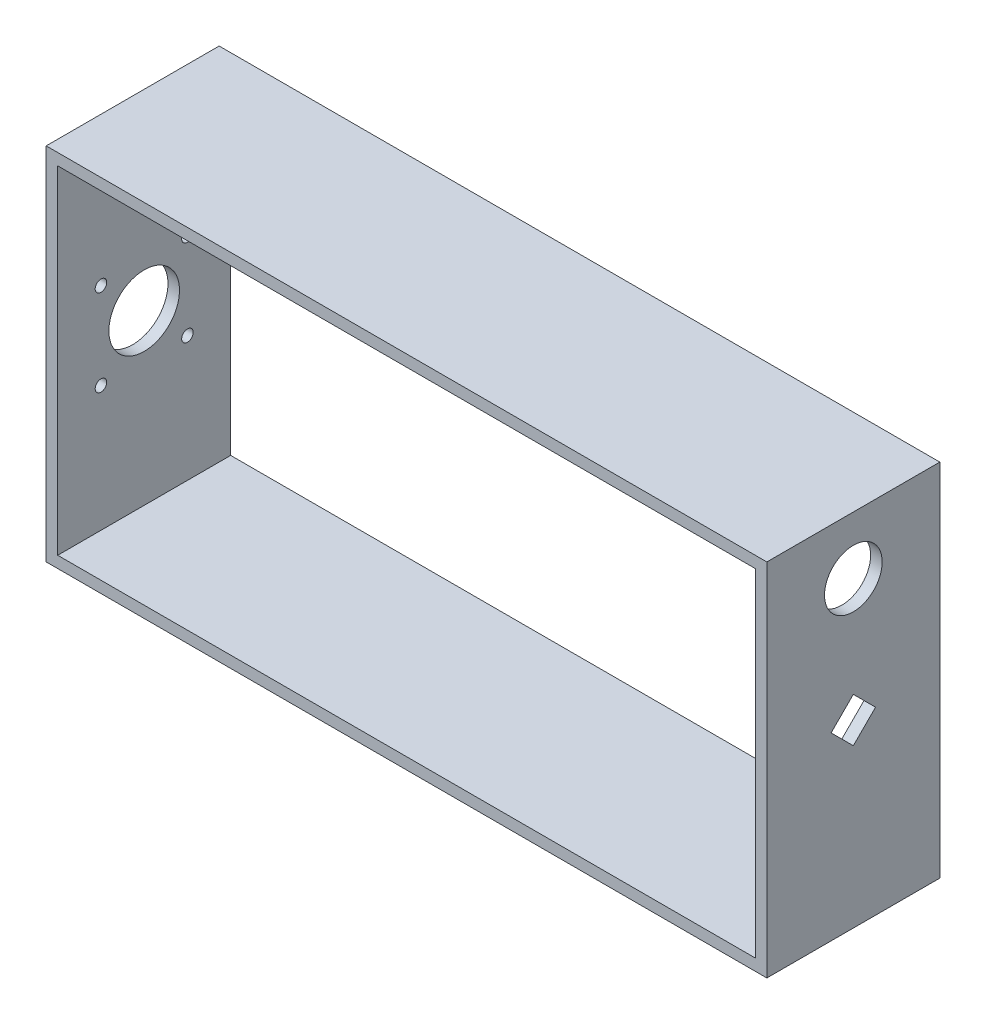
from build123d import *

# Parameters (mm, degrees)
SKIZZE1_W                       = 250
SKIZZE1_H                       = 125
SKIZZE1_W_2                     = 242
SKIZZE1_H_2                     = 117
AUFSATZ_LINEAR_AUSTRAGEN1_DEPTH = 60
SKIZZE2_R                       = 12.25
SKIZZE2_R_2                     = 2
SCHNITT_LINEAR_AUSTRAGEN1_DEPTH = 10
SKIZZE8_R                       = 10
SCHNITT_LINEAR_AUSTRAGEN6_DEPTH = 12


with BuildPart() as part:
    # Skizze1 → Aufsatz-Linear austragen1 (new body)
    with BuildSketch(Plane.XY):
        with Locations((125, 62.5)):
            Rectangle(SKIZZE1_W, SKIZZE1_H)
        with Locations((125, 62.5)):
            Rectangle(SKIZZE1_W_2, SKIZZE1_H_2, mode=Mode.SUBTRACT)
    extrude(amount=AUFSATZ_LINEAR_AUSTRAGEN1_DEPTH)

    # Skizze2 → Schnitt-Linear austragen1 (cut)
    with BuildSketch(Plane.ZY):
        with Locations((30, 62.5)):
            Circle(SKIZZE2_R)
        with Locations((15, 77.5)):
            Circle(SKIZZE2_R_2)
        with Locations((45, 77.5)):
            Circle(SKIZZE2_R_2)
        with Locations((45, 47.5)):
            Circle(SKIZZE2_R_2)
        with Locations((15, 47.5)):
            Circle(SKIZZE2_R_2)
    extrude(amount=-SCHNITT_LINEAR_AUSTRAGEN1_DEPTH, mode=Mode.SUBTRACT)

    # Skizze8 → Schnitt-Linear austragen6 (cut)
    with BuildSketch(Plane(origin=(250, 0, 0), x_dir=(0, 0, -1), z_dir=(1, 0, 0))):
        with Locations((-30, 105)):
            Circle(SKIZZE8_R)
        Polygon((-30, 70.207463915), (-37.707463915, 62.5), (-30, 54.792536085), (-22.292536085, 62.5), align=None)
    extrude(amount=-SCHNITT_LINEAR_AUSTRAGEN6_DEPTH, mode=Mode.SUBTRACT)


solid = part.part
